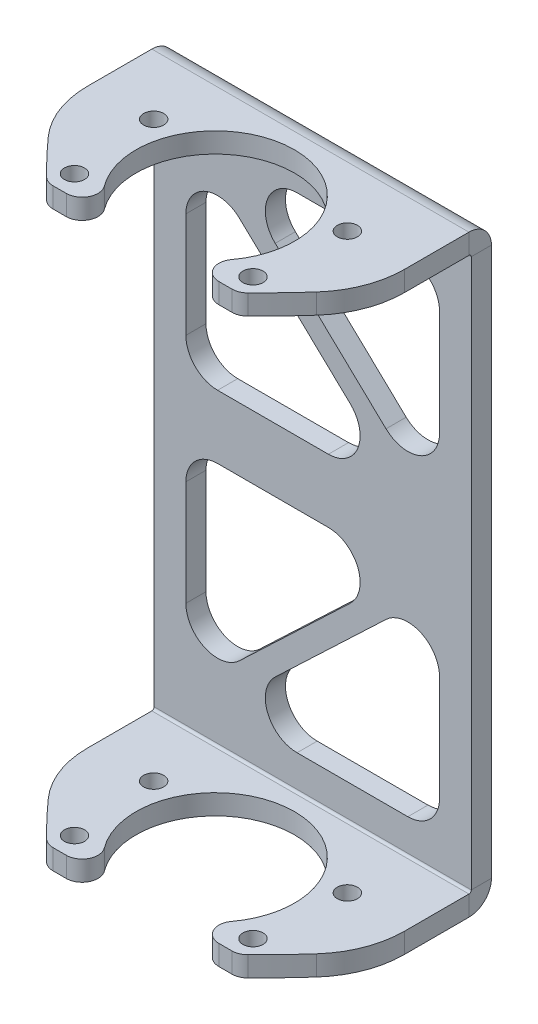
from build123d import *

# Parameters (mm, degrees)
SKETCH1_W                    = 100
SKETCH1_H                    = 60
BASE_FLANGE1_DEPTH           = 6.35
EDGE_FLANGE2_STRIP_W         = 26.8732
EDGE_FLANGE2_STRIP_H         = 6.35
EDGE_FLANGE2_STRIP_CUT_DEPTH = 100
EDGE_FLANGE2_DEPTH           = 100
EDGE_FLANGE3_STRIP_W         = 26.8732
EDGE_FLANGE3_STRIP_H         = 6.35
EDGE_FLANGE3_STRIP_CUT_DEPTH = 100
EDGE_FLANGE3_DEPTH           = 100
SKETCH27_R                   = 25
CUT_EXTRUDE2_DEPTH           = 196.975534187
FILLET3_R                    = 5
F_1_4_0_25_DIAMETER_HOLE1_D  = 6.35
CUT_EXTRUDE3_DEPTH           = 203.74715781
CUT_EXTRUDE4_DEPTH           = 196.975534187
FILLET4_R                    = 30
FILLET5_R                    = 5


# Sheet-metal steps are written as plain solids
with BuildPart() as part:
    # Sketch1 → Base-Flange1 (new body)
    with BuildSketch(Plane(origin=(0, 0, 0), x_dir=(1, 0, 0), z_dir=(0, 1, 0))):
        Rectangle(SKETCH1_W, SKETCH1_H)
    extrude(amount=-BASE_FLANGE1_DEPTH)

    # Edge-Flange2 strip (across the edge) → Edge-Flange2 strip cut (cut)
    with BuildSketch(Plane(origin=(-50, -6.35, -30), x_dir=(0, 0, 1), z_dir=(1, 0, 0))):
        with Locations((-6.35, -3.175)):
            Rectangle(EDGE_FLANGE2_STRIP_W, EDGE_FLANGE2_STRIP_H)
    extrude(amount=EDGE_FLANGE2_STRIP_CUT_DEPTH, mode=Mode.SUBTRACT)

    # Edge-Flange2 section (across the edge) → Edge-Flange2 (add)
    with BuildSketch(Plane(origin=(-50, -6.35, -30), x_dir=(0, 0, 1), z_dir=(1, 0, 0))):
        with BuildLine():
            Line((0, 0.7366), (0, 180.75))
            Line((0, 180.75), (6.35, 180.75))
            Line((6.35, 180.75), (6.35, 0.7366))
            ThreePointArc((6.35, 0.7366), (6.565745145, 0.215745145), (7.0866, 0))
            Line((7.0866, 0), (7.0866, -6.35))
            ThreePointArc((7.0866, -6.35), (2.075617084, -4.274382916), (0, 0.7366))
        make_face()
    extrude(amount=EDGE_FLANGE2_DEPTH)

    # Edge-Flange3 strip (across the edge) → Edge-Flange3 strip cut (cut)
    with BuildSketch(Plane(origin=(-50, -187.1, -23.65), x_dir=(0, 1, 0), z_dir=(1, 0, 0))):
        with Locations((-6.35, -3.175)):
            Rectangle(EDGE_FLANGE3_STRIP_W, EDGE_FLANGE3_STRIP_H)
    extrude(amount=EDGE_FLANGE3_STRIP_CUT_DEPTH, mode=Mode.SUBTRACT)

    # Edge-Flange3 section (across the edge) → Edge-Flange3 (add)
    with BuildSketch(Plane(origin=(-50, -187.1, -23.65), x_dir=(0, 1, 0), z_dir=(1, 0, 0))):
        with BuildLine():
            Line((0, 0.7366), (0, 53.65))
            Line((0, 53.65), (6.35, 53.65))
            Line((6.35, 53.65), (6.35, 0.7366))
            ThreePointArc((6.35, 0.7366), (6.565745145, 0.215745145), (7.0866, 0))
            Line((7.0866, 0), (7.0866, -6.35))
            ThreePointArc((7.0866, -6.35), (2.075617084, -4.274382916), (0, 0.7366))
        make_face()
    extrude(amount=EDGE_FLANGE3_DEPTH)

    # Sketch27 → Cut-Extrude2 (cut, through all)
    with BuildSketch(Plane.XZ.offset(187.1)):
        with Locations((0, 7.0866)):
            Circle(SKETCH27_R)
    extrude(amount=-CUT_EXTRUDE2_DEPTH, mode=Mode.SUBTRACT)

    # Fillet3
    fillet3_edges = [part.edges().sort_by_distance(p)[0] for p in [
        (-50, -183.925, 30),
        (50, -183.925, 30),
        (50, -3.175, 30),
        (-50, -3.175, 30),
        (9.998804951, -183.925, 30),
        (-9.998804951, -183.925, 30),
        (-9.998804951, -3.175, 30),
        (9.998804951, -3.175, 30),
    ]]
    fillet(fillet3_edges, radius=FILLET3_R)

    # 1/4 (0.25) Diameter Hole1 (through all)
    with Locations(Plane(origin=(0, 0, 0), x_dir=(1, 0, 0), z_dir=(0, 1, 0))):
        with Locations((28.145825623, -23.3366), (-30.540010176, 4.029054658), (30.540010176, 4.029054658), (-28.145825623, -23.3366)):
            Hole(F_1_4_0_25_DIAMETER_HOLE1_D / 2)

    # Sketch30 → Cut-Extrude3 (cut, through all)
    with BuildSketch(Plane(origin=(0, 0, -30), x_dir=(-1, 0, 0), z_dir=(0, 0, -1))):
        with BuildLine():
            Line((-40, -27.0866), (-40, -60.265715002))
            ThreePointArc((-40, -60.265715002), (-33.94619985, -69.454159198), (-23.114498651, -67.517602423))
            Line((-23.114498651, -67.517602423), (11.830118238, -34.338487421))
            ThreePointArc((11.830118238, -34.338487421), (14.232212762, -23.379773474), (4.944616889, -17.0866))
            Line((4.944616889, -17.0866), (-30, -17.0866))
            ThreePointArc((-30, -17.0866), (-37.071067812, -20.015532188), (-40, -27.0866))
        make_face()
        with BuildLine():
            Line((23.114498651, -33.118997577), (-11.830118238, -66.298112579))
            ThreePointArc((-11.830118238, -66.298112579), (-14.232212762, -77.256826526), (-4.944616889, -83.55))
            Line((-4.944616889, -83.55), (30, -83.55))
            ThreePointArc((30, -83.55), (37.071067812, -80.621067812), (40, -73.55))
            Line((40, -73.55), (40, -40.370884998))
            ThreePointArc((40, -40.370884998), (33.94619985, -31.182440802), (23.114498651, -33.118997577))
        make_face()
        with BuildLine():
            Line((-23.114498651, -119.582397577), (11.830118238, -152.761512579))
            ThreePointArc((11.830118238, -152.761512579), (14.232212762, -163.720226526), (4.944616889, -170.0134))
            Line((4.944616889, -170.0134), (-30, -170.0134))
            ThreePointArc((-30, -170.0134), (-37.071067812, -167.084467812), (-40, -160.0134))
            Line((-40, -160.0134), (-40, -126.834284998))
            ThreePointArc((-40, -126.834284998), (-33.94619985, -117.645840802), (-23.114498651, -119.582397577))
        make_face()
        with BuildLine():
            Line((-4.944616889, -103.55), (30, -103.55))
            ThreePointArc((30, -103.55), (37.071067812, -106.478932188), (40, -113.55))
            Line((40, -113.55), (40, -146.729115002))
            ThreePointArc((40, -146.729115002), (33.94619985, -155.917559198), (23.114498651, -153.981002423))
            Line((23.114498651, -153.981002423), (-11.830118238, -120.801887421))
            ThreePointArc((-11.830118238, -120.801887421), (-14.232212762, -109.843173474), (-4.944616889, -103.55))
        make_face()
    extrude(amount=-CUT_EXTRUDE3_DEPTH, mode=Mode.SUBTRACT)

    # Sketch31 → Cut-Extrude4 (cut, through all)
    with BuildSketch(Plane.XZ.offset(187.1)):
        with BuildLine():
            Line((30.246393456, 30), (50, 30))
            Line((50, 30), (50, 8.486121202))
            ThreePointArc((50, 8.486121202), (40.425530077, 19.520656941), (30.246393456, 30))
        make_face()
        with BuildLine():
            Line((-30.246393456, 30), (-50, 30))
            Line((-50, 30), (-50, 8.486121202))
            ThreePointArc((-50, 8.486121202), (-40.425530077, 19.520656941), (-30.246393456, 30))
        make_face()
    extrude(amount=-CUT_EXTRUDE4_DEPTH, mode=Mode.SUBTRACT)

    # Fillet4
    fillet4_edges = [part.edges().sort_by_distance(p)[0] for p in [
        (50, -3.175, 8.486121202),
        (50, -183.925, 8.486121202),
        (-50, -3.175, 8.486121202),
        (-50, -183.925, 8.486121202),
    ]]
    fillet(fillet4_edges, radius=FILLET4_R)

    # Fillet5
    fillet5_edges = [part.edges().sort_by_distance(p)[0] for p in [
        (30.246393456, -3.175, 30),
        (30.246393456, -183.925, 30),
        (-30.246393456, -3.175, 30),
        (-30.246393456, -183.925, 30),
    ]]
    fillet(fillet5_edges, radius=FILLET5_R)


solid = part.part
